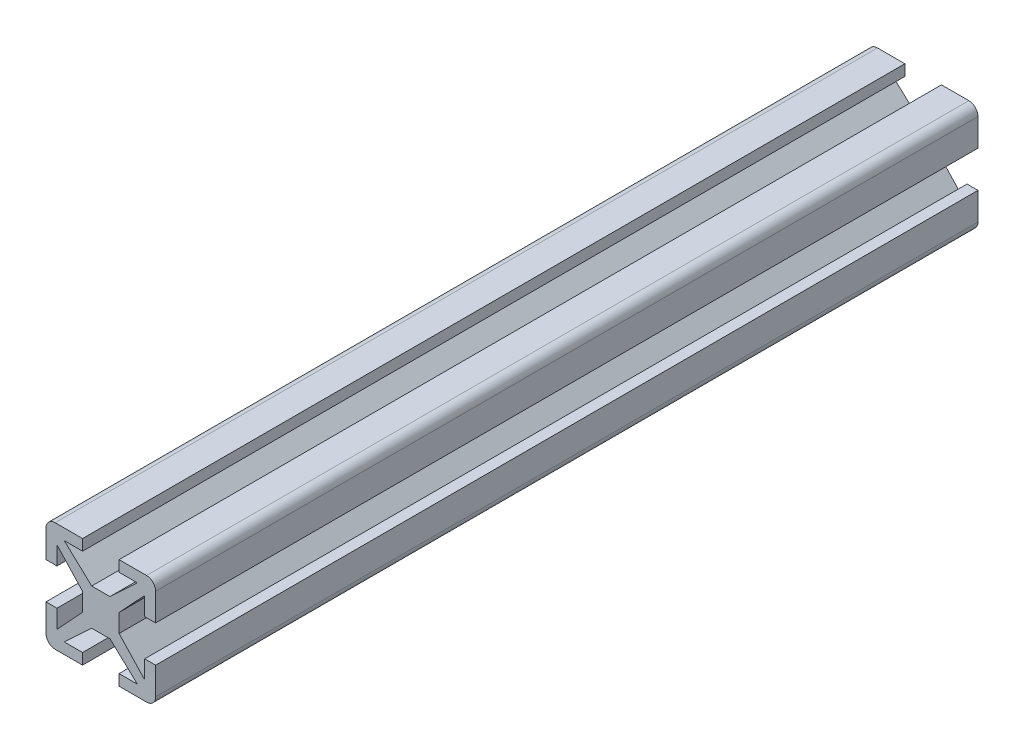
from build123d import *

# Parameters (mm, degrees)
EXTRUSION1_DEPTH             = 45
ENL_V_MAT_EXTRU_1_DEPTH      = 91.39911504
R_P_TITION_CIRCULAIRE1_COUNT = 4


with BuildPart() as part:
    # Esquisse1 → Extrusion1 (new, symmetric)
    with BuildSketch(Plane.XY):
        with BuildLine():
            Line((-6, 5), (-6, -5))
            ThreePointArc((-6, -5), (-5.707106781, -5.707106781), (-5, -6))
            Line((-5, -6), (5, -6))
            ThreePointArc((5, -6), (5.707106781, -5.707106781), (6, -5))
            Line((6, -5), (6, 5))
            ThreePointArc((6, 5), (5.707106781, 5.707106781), (5, 6))
            Line((5, 6), (-5, 6))
            ThreePointArc((-5, 6), (-5.707106781, 5.707106781), (-6, 5))
        make_face()
    extrude(amount=EXTRUSION1_DEPTH, both=True)

    # Esquisse3 → Enlèv. mat.-Extru.1 (cut, through all)
    with BuildSketch(Plane.XY.offset(45)):
        Polygon((6, 2), (4.8, 2), (4.8, 4), (2, 1), (2, -1), (4.8, -4), (4.8, -2), (6, -2), align=None)
    enl_v_mat_extru_1 = extrude(amount=-ENL_V_MAT_EXTRU_1_DEPTH, mode=Mode.SUBTRACT)

    # Répétition circulaire1: Enlèv. mat.-Extru.1 ×4 about axis
    r_p_tition_circulaire1_axis = Axis((0, 0, -1), (0, 0, 1))
    for i in range(1, R_P_TITION_CIRCULAIRE1_COUNT):
        add(enl_v_mat_extru_1.rotate(r_p_tition_circulaire1_axis, i * 360 / R_P_TITION_CIRCULAIRE1_COUNT), mode=Mode.SUBTRACT)


solid = part.part
